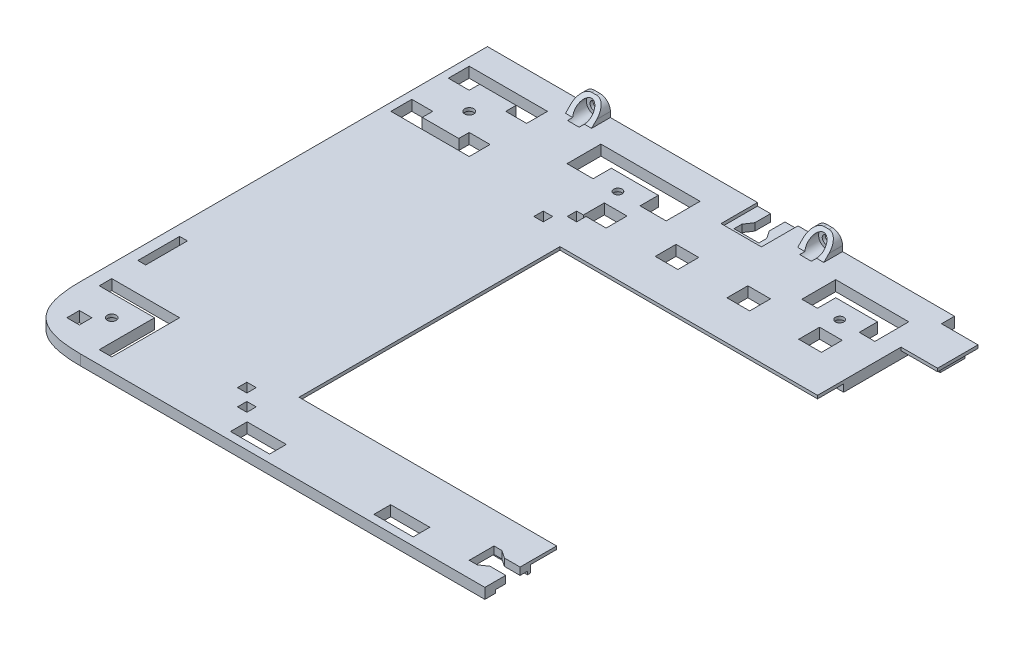
from build123d import *

# Parameters (mm, degrees)
SKETCH1_W                                  = 337
SKETCH1_H                                  = 377.97
SKETCH1_W_2                                = 240
SKETCH1_H_2                                = 120
BOSS_EXTRUDE1_DEPTH                        = 4
FILLET1_SIZE                               = 24
SKETCH3_R                                  = 1.75
SKETCH3_R_2                                = 2
SKETCH3_R_3                                = 1.6
SKETCH3_R_4                                = 1.2
SKETCH3_W                                  = 4.8
SKETCH3_H                                  = 4.8
SKETCH3_W_2                                = 3
SKETCH3_H_2                                = 16
SKETCH3_W_3                                = 4
SKETCH3_H_3                                = 24
SKETCH3_W_4                                = 120
SKETCH3_H_4                                = 135.5
SKETCH3_W_5                                = 16
SKETCH3_H_5                                = 4
SKETCH3_W_6                                = 32
CUT_EXTRUDE1_DEPTH                         = 4
CUT_EXTRUDE2_REACH                         = 508.405
SKETCH5_W                                  = 3.6
SKETCH5_H                                  = 3.6
MIRROR1_AT_THE_SECOND_PLANE_COPY_1_REACH   = 508.405
MIRROR1_AT_THE_SECOND_PLANE_COPY_1_SKETC_W = 3.6
MIRROR1_AT_THE_SECOND_PLANE_COPY_1_SKETC_H = 3.6
SKETCH6_R                                  = 3.5
SKETCH6_R_2                                = 3
CUT_EXTRUDE3_DEPTH                         = 2.8
CUT_EXTRUDE4_REACH                         = 508.405
SKETCH7_W                                  = 8.7
SKETCH7_H                                  = 8
LPATTERN1_COUNT                            = 8
LPATTERN1_PITCH                            = 27.5
CUT_EXTRUDE5_REACH                         = 508.405
CUT_EXTRUDE6_REACH                         = 508.405
SKETCH9_R                                  = 1.6
SKETCH10_R                                 = 3.5
CUT_EXTRUDE7_DEPTH                         = 2.8
CUT_EXTRUDE8_REACH                         = 508.405
SKETCH11_R                                 = 1.6
SKETCH12_R                                 = 3.5
CUT_EXTRUDE9_DEPTH                         = 2.8
SKETCH13_W                                 = 15
SKETCH13_H                                 = 6.4
CUT_EXTRUDE10_DEPTH                        = 4
LPATTERN2_COUNT                            = 4
LPATTERN2_PITCH                            = 55
SKETCH15_W                                 = 240
SKETCH15_H                                 = 120
SKETCH15_W_2                               = 105
SKETCH15_H_2                               = 100
BOSS_EXTRUDE2_DEPTH                        = 1.2
CUT_EXTRUDE11_REACH                        = 508.405
SKETCH17_W                                 = 158
SKETCH17_H                                 = 180
CUT_EXTRUDE12_REACH                        = 508.405
SKETCH19_W                                 = 158
SKETCH19_H                                 = 197.97
CUT_EXTRUDE13_REACH                        = 420.232
SKETCH18_W                                 = 179
SKETCH18_H                                 = 197.97
CUT_EXTRUDE14_REACH                        = 255.884
SKETCH21_W                                 = 14
SKETCH21_H                                 = 12.3
CUT_EXTRUDE17_DEPTH                        = 1.2
BOSS_EXTRUDE3_DEPTH                        = 4
SKETCH23_W                                 = 14
SKETCH23_H                                 = 15.5
BOSS_EXTRUDE4_DEPTH                        = 1.2
SKETCH24_W                                 = 10
SKETCH24_H                                 = 1.2
BOSS_EXTRUDE5_DEPTH                        = 6
CUT_EXTRUDE18_REACH                        = 265.979
SKETCH25_R                                 = 1.6
CHAMFER1_SIZE                              = 6
SKETCH26_R                                 = 3
CUT_EXTRUDE21_DEPTH                        = 8
FILLET2_R                                  = 4
MIRROR3_START                              = -178.8
MIRROR3_OUTLINE_R                          = 3
MIRROR3_OUTLINE_R_2                        = 1.6
MIRROR3_DEPTH                              = 8
MIRROR3_START_2                            = -180
MIRROR3_2_OUTLINE_R                        = 3
MIRROR3_2_OUTLINE_R_2                      = 1.6
MIRROR3_2_DEPTH                            = 1.2
MIRROR3_3_DEPTH                            = 7.2
MIRROR3_START_3                            = 122.188051789
MIRROR3_4_OUTLINE_W                        = 10
MIRROR3_4_OUTLINE_H                        = 6.188051789
MIRROR3_4_DEPTH                            = 9.333809512
CUT_EXTRUDE22_REACH                        = 265.979
SKETCH28_W                                 = 15.5
SKETCH28_H                                 = 14
CUT_EXTRUDE23_DEPTH                        = 1.2


with BuildPart() as part:
    # Sketch1 → Boss-Extrude1 (new body)
    with BuildSketch(Plane(origin=(0, 0, 0), x_dir=(1, 0, 0), z_dir=(0, 1, 0))):
        with Locations((168.5, 188.985)):
            Rectangle(SKETCH1_W, SKETCH1_H)
        with Locations((190.28, 77.5)):
            Rectangle(SKETCH1_W_2, SKETCH1_H_2, mode=Mode.SUBTRACT)
    extrude(amount=-BOSS_EXTRUDE1_DEPTH)

    # Fillet1
    # a fillet whose section is not a circle: 24 mm, written as the material it takes off along each edge
    with BuildSketch(Plane(origin=(0, 60, 0), x_dir=(1, 0, 0), z_dir=(0, -1, 0))) as fillet1_piece_1:
        with BuildLine():
            Bezier((FILLET1_SIZE, 0), (0, 0), (0, -FILLET1_SIZE), weights=[1, 1.222222222, 1])
            Line((0, -FILLET1_SIZE), (0, 0))
            Line((0, 0), (FILLET1_SIZE, 0))
        make_face()
    extrude(amount=124, mode=Mode.SUBTRACT)
    with BuildSketch(Plane(origin=(337, 60, 0), x_dir=(-1, 0, 0), z_dir=(0, -1, 0)), Plane(origin=(0, 60, -377.97), x_dir=(1, 0, 0), z_dir=(0, -1, 0)), Plane(origin=(337, 60, -377.97), x_dir=(0, 0, 1), z_dir=(0, -1, 0))) as fillet1_piece_2:
        with BuildLine():
            Bezier((FILLET1_SIZE, 0), (0, 0), (0, FILLET1_SIZE), weights=[1, 1.222222222, 1])
            Line((0, FILLET1_SIZE), (0, 0))
            Line((0, 0), (FILLET1_SIZE, 0))
        make_face()
    extrude(amount=124, mode=Mode.SUBTRACT)

    # Sketch3 → Cut-Extrude1 (cut)
    with BuildSketch(Plane(origin=(0, 0, 0), x_dir=(1, 0, 0), z_dir=(0, 1, 0))):
        with Locations(Location((322, 15, 0), (0, 0, 270))):
            Circle(SKETCH3_R)
        with Locations(Location((18, 18, 0), (0, 0, 270))):
            Circle(SKETCH3_R)
        with Locations(Location((18, 155, 0), (0, 0, 270))):
            Circle(SKETCH3_R)
        with Locations(Location((325, 160, 0), (0, 0, 270))):
            Circle(SKETCH3_R)
        with Locations(Location((195.4, 373.97, 0), (0, 0, 270))):
            Circle(SKETCH3_R_2)
        with Locations(Location((293, 347.97, 0), (0, 0, 270))):
            Circle(SKETCH3_R_2)
        with Locations(Location((315, 366.97, 0), (0, 0, 270))):
            Circle(SKETCH3_R_3)
        with Locations(Location((326, 366.97, 0), (0, 0, 270))):
            Circle(SKETCH3_R_4)
        with Locations(Location((11, 355.97, 0), (0, 0, 270))):
            Circle(SKETCH3_R_3)
        with Locations(Location((11, 365.97, 0), (0, 0, 270))):
            Circle(SKETCH3_R_4)
        with Locations(Location((223.4, 372.97, 0), (0, 0, 270))):
            Circle(SKETCH3_R_3)
        Polygon((309, 4), (309, 2), (305, 2), (305, 10.5), (309, 10.5), (309, 8.5), (313, 8.5), (313, 4), align=None)
        Polygon((329, 28), (333, 28), (333, 32), (319.28, 32), (319.28, 28), (323.28, 28), (323.28, 24), (329, 24), align=None)
        Polygon((328, 151), (334, 151), (334, 147), (316, 147), (316, 151), (322, 151), (322, 155), (328, 155), align=None)
        Polygon((26.2, 5), (31, 5), (31, 31), (26, 31), (5, 31), (5, 26.2), (26.2, 26.2), align=None)
        with Locations((11.8, 11.8)):
            Rectangle(SKETCH3_W, SKETCH3_H)
        Polygon((3, 140), (33, 140), (33, 144), (33, 148), (25, 148), (25, 144), (11, 144), (11, 148), (3, 148), (3, 144), align=None)
        Polygon((3, 170), (33, 170), (33, 166), (33, 162), (25, 162), (25, 166), (11, 166), (11, 162), (3, 162), (3, 166), align=None)
        Polygon((328, 169), (334, 169), (334, 173), (316, 173), (316, 169), (322, 169), (322, 165), (328, 165), align=None)
        with Locations((331.5, 50)):
            Rectangle(SKETCH3_W_2, SKETCH3_H_2)
        with Locations((5.5, 50)):
            Rectangle(SKETCH3_W_2, SKETCH3_H_2)
        with Locations((189.4, 343.97)):
            Rectangle(SKETCH3_W_3, SKETCH3_H_2)
        with Locations((189.4, 299.97)):
            Rectangle(SKETCH3_W_3, SKETCH3_H_3)
        with Locations((267, 267.22)):
            Rectangle(SKETCH3_W_4, SKETCH3_H_4)
        with Locations((319, 191.47)):
            Rectangle(SKETCH3_W_5, SKETCH3_H_5)
        with Locations((271, 191.47)):
            Rectangle(SKETCH3_W_5, SKETCH3_H_5)
        with Locations((223, 191.47)):
            Rectangle(SKETCH3_W_5, SKETCH3_H_5)
        with Locations((245, 342.97)):
            Rectangle(SKETCH3_W_6, SKETCH3_H_5)
        Polygon((332, 355.97), (304, 355.97), (304, 359.97), (304, 373.97), (308, 373.97), (308, 359.97), (332, 359.97), align=None)
        Polygon((18, 372.97), (22, 372.97), (22, 344.97), (18, 344.97), (4, 344.97), (4, 348.97), (18, 348.97), align=None)
    extrude(amount=-CUT_EXTRUDE1_DEPTH, mode=Mode.SUBTRACT)

    # Sketch5 → Cut-Extrude2 (cut, up to next)
    with BuildSketch(Plane(origin=(0, 0, 0), x_dir=(1, 0, 0), z_dir=(0, 1, 0)), mode=Mode.PRIVATE) as cut_extrude2_sk1:
        with Locations((313.48, 20.7)):
            Rectangle(SKETCH5_W, SKETCH5_H)
    cut_extrude2_tool1 = extrude(cut_extrude2_sk1.sketch, amount=-CUT_EXTRUDE2_REACH, mode=Mode.PRIVATE) & part.part
    # Sketch5 → Cut-Extrude2 (cut, up to next)
    with BuildSketch(Plane(origin=(0, 0, 0), x_dir=(1, 0, 0), z_dir=(0, 1, 0)), mode=Mode.PRIVATE) as cut_extrude2_sk2:
        with Locations((307.08, 14.3)):
            Rectangle(SKETCH5_W, SKETCH5_H)
    cut_extrude2_tool2 = extrude(cut_extrude2_sk2.sketch, amount=-CUT_EXTRUDE2_REACH, mode=Mode.PRIVATE) & part.part
    cut_extrude2_1 = cut_extrude2_tool1.solids().sort_by_distance((313.48, 0, -20.7))[0]
    add(cut_extrude2_1, mode=Mode.SUBTRACT)
    cut_extrude2_2 = cut_extrude2_tool2.solids().sort_by_distance((307.08, 0, -14.3))[0]
    add(cut_extrude2_2, mode=Mode.SUBTRACT)
    cut_extrude2 = cut_extrude2_1 + cut_extrude2_2  # Cut-Extrude2 as one shape, for the pattern or mirror that repeats it

    # Mirror1: Cut-Extrude2 across plane
    add(cut_extrude2.mirror(Plane.XY.offset(-77.5)), mode=Mode.SUBTRACT)

    # Mirror1 at the second plane: Cut-Extrude2 across plane
    add(cut_extrude2.mirror(Plane.ZY.offset(-190.28)), mode=Mode.SUBTRACT)

    # Mirror1 at the second plane copy 1 sketc → Mirror1 at the second plane copy 1 (cut, up to next)
    with BuildSketch(Plane(origin=(380.56, 0, -155), x_dir=(-1, 0, 0), z_dir=(0, 1, 0)), mode=Mode.PRIVATE) as mirror1_at_the_second_plane_copy_1_sk1:
        with Locations((313.48, 20.7)):
            Rectangle(MIRROR1_AT_THE_SECOND_PLANE_COPY_1_SKETC_W, MIRROR1_AT_THE_SECOND_PLANE_COPY_1_SKETC_H)
    mirror1_at_the_second_plane_copy_1_tool1 = extrude(mirror1_at_the_second_plane_copy_1_sk1.sketch, amount=-MIRROR1_AT_THE_SECOND_PLANE_COPY_1_REACH, mode=Mode.PRIVATE) & part.part
    # Mirror1 at the second plane copy 1 sketc → Mirror1 at the second plane copy 1 (cut, up to next)
    with BuildSketch(Plane(origin=(380.56, 0, -155), x_dir=(-1, 0, 0), z_dir=(0, 1, 0)), mode=Mode.PRIVATE) as mirror1_at_the_second_plane_copy_1_sk2:
        with Locations((307.08, 14.3)):
            Rectangle(MIRROR1_AT_THE_SECOND_PLANE_COPY_1_SKETC_W, MIRROR1_AT_THE_SECOND_PLANE_COPY_1_SKETC_H)
    mirror1_at_the_second_plane_copy_1_tool2 = extrude(mirror1_at_the_second_plane_copy_1_sk2.sketch, amount=-MIRROR1_AT_THE_SECOND_PLANE_COPY_1_REACH, mode=Mode.PRIVATE) & part.part
    add(mirror1_at_the_second_plane_copy_1_tool1.solids().sort_by_distance((67.08, 0, -134.3))[0], mode=Mode.SUBTRACT)
    add(mirror1_at_the_second_plane_copy_1_tool2.solids().sort_by_distance((73.48, 0, -140.7))[0], mode=Mode.SUBTRACT)

    # Sketch6 → Cut-Extrude3 (cut)
    with BuildSketch(Plane.XZ.offset(4)):
        with Locations(Location((18, -155, 0), (0, 0, 270))):
            Circle(SKETCH6_R)
        with Locations(Location((18, -18, 0), (0, 0, 270))):
            Circle(SKETCH6_R)
        with Locations(Location((322, -15, 0), (0, 0, 270))):
            Circle(SKETCH6_R)
        with Locations(Location((325, -160, 0), (0, 0, 270))):
            Circle(SKETCH6_R)
        with Locations(Location((195.4, -373.97, 0), (0, 0, 270))):
            Circle(SKETCH6_R)
        with Locations(Location((293, -347.97, 0), (0, 0, 270))):
            Circle(SKETCH6_R)
        with Locations(Location((315, -366.97, 0), (0, 0, 270))):
            Circle(SKETCH6_R)
        with Locations(Location((326, -366.97, 0), (0, 0, 270))):
            Circle(SKETCH6_R_2)
        with Locations(Location((11, -355.97, 0), (0, 0, 270))):
            Circle(SKETCH6_R)
        with Locations(Location((11, -365.97, 0), (0, 0, 270))):
            Circle(SKETCH6_R_2)
        with Locations(Location((223.4, -372.97, 0), (0, 0, 270))):
            Circle(SKETCH6_R)
    extrude(amount=-CUT_EXTRUDE3_DEPTH, mode=Mode.SUBTRACT)

    # Sketch7 → Cut-Extrude4 (cut, up to next)
    with BuildSketch(Plane(origin=(0, 0, 0), x_dir=(1, 0, 0), z_dir=(0, 1, 0)), mode=Mode.PRIVATE) as cut_extrude4_sk1:
        with Locations((271.13, 146.5)):
            Rectangle(SKETCH7_W, SKETCH7_H)
    cut_extrude4_tool1 = extrude(cut_extrude4_sk1.sketch, amount=-CUT_EXTRUDE4_REACH, mode=Mode.PRIVATE) & part.part
    cut_extrude4 = cut_extrude4_tool1.solids().sort_by_distance((271.13, 0, -146.5))[0]
    add(cut_extrude4, mode=Mode.SUBTRACT)

    # LPattern1: Cut-Extrude4 ×8
    with Locations(*[(-i * LPATTERN1_PITCH, 0, 0) for i in range(1, LPATTERN1_COUNT)]):
        add(cut_extrude4, mode=Mode.SUBTRACT)

    # Sketch8 → Cut-Extrude5 (cut, up to next)
    with BuildSketch(Plane(origin=(0, 0, 0), x_dir=(1, 0, 0), z_dir=(0, 1, 0)), mode=Mode.PRIVATE) as cut_extrude5_sk1:
        Polygon((262.1, 156.38), (252.1, 156.38), (252.1, 163.38), (234.1, 163.38), (234.1, 156.38), (224.1, 156.38), (224.1, 163.38), (224.1, 169.38), (262.1, 169.38), (262.1, 163.38), align=None)
    cut_extrude5_tool1 = extrude(cut_extrude5_sk1.sketch, amount=-CUT_EXTRUDE5_REACH, mode=Mode.PRIVATE) & part.part
    cut_extrude5 = cut_extrude5_tool1.solids().sort_by_distance((243.1, 0, -163.907174))[0]
    add(cut_extrude5, mode=Mode.SUBTRACT)

    # Sketch9 → Cut-Extrude6 (cut, up to next)
    with BuildSketch(Plane(origin=(0, 0, 0), x_dir=(1, 0, 0), z_dir=(0, 1, 0)), mode=Mode.PRIVATE) as cut_extrude6_sk1:
        with Locations(Location((243.1, 156.88, 0), (0, 0, 270))):
            Circle(SKETCH9_R)
    cut_extrude6_tool1 = extrude(cut_extrude6_sk1.sketch, amount=-CUT_EXTRUDE6_REACH, mode=Mode.PRIVATE) & part.part
    cut_extrude6 = cut_extrude6_tool1.solids().sort_by_distance((243.1, 0, -156.88))[0]
    add(cut_extrude6, mode=Mode.SUBTRACT)

    # Sketch10 → Cut-Extrude7 (cut)
    with BuildSketch(Plane.XZ.offset(4)):
        with Locations(Location((243.1, -156.88, 0), (0, 0, 270))):
            Circle(SKETCH10_R)
    cut_extrude7 = extrude(amount=-CUT_EXTRUDE7_DEPTH, mode=Mode.SUBTRACT)

    # Mirror2: Cut-Extrude5, Cut-Extrude6, Cut-Extrude7 across plane
    add(cut_extrude5.mirror(Plane(origin=(158.1, 0, 0), x_dir=(0, 0, 1), z_dir=(1, 0, 0))), mode=Mode.SUBTRACT)
    add(cut_extrude6.mirror(Plane(origin=(158.1, 0, 0), x_dir=(0, 0, 1), z_dir=(1, 0, 0))), mode=Mode.SUBTRACT)
    add(cut_extrude7.mirror(Plane(origin=(158.1, 0, 0), x_dir=(0, 0, 1), z_dir=(1, 0, 0))), mode=Mode.SUBTRACT)

    # Sketch11 → Cut-Extrude8 (cut, up to next)
    with BuildSketch(Plane(origin=(0, 0, 0), x_dir=(1, 0, 0), z_dir=(0, 1, 0)), mode=Mode.PRIVATE) as cut_extrude8_sk1:
        with Locations(Location((158.1, 156.88, 0), (0, 0, 270))):
            Circle(SKETCH11_R)
    cut_extrude8_tool1 = extrude(cut_extrude8_sk1.sketch, amount=-CUT_EXTRUDE8_REACH, mode=Mode.PRIVATE) & part.part
    # Sketch11 → Cut-Extrude8 (cut, up to next)
    with BuildSketch(Plane(origin=(0, 0, 0), x_dir=(1, 0, 0), z_dir=(0, 1, 0)), mode=Mode.PRIVATE) as cut_extrude8_sk2:
        Polygon((172.1, 169.38), (144.1, 169.38), (144.1, 163.38), (144.1, 156.38), (150.1, 156.38), (150.1, 163.38), (166.1, 163.38), (166.1, 156.38), (172.1, 156.38), (172.1, 163.38), align=None)
    cut_extrude8_tool2 = extrude(cut_extrude8_sk2.sketch, amount=-CUT_EXTRUDE8_REACH, mode=Mode.PRIVATE) & part.part
    add(cut_extrude8_tool1.solids().sort_by_distance((158.1, 0, -156.88))[0], mode=Mode.SUBTRACT)
    add(cut_extrude8_tool2.solids().sort_by_distance((158.1, 0, -164.213333))[0], mode=Mode.SUBTRACT)

    # Sketch12 → Cut-Extrude9 (cut)
    with BuildSketch(Plane.XZ.offset(4)):
        with Locations(Location((158.1, -156.88, 0), (0, 0, 270))):
            Circle(SKETCH12_R)
    extrude(amount=-CUT_EXTRUDE9_DEPTH, mode=Mode.SUBTRACT)

    # Sketch13 → Cut-Extrude10 (cut)
    with BuildSketch(Plane(origin=(0, 0, 0), x_dir=(1, 0, 0), z_dir=(0, 1, 0))):
        with Locations((86, 6.2)):
            Rectangle(SKETCH13_W, SKETCH13_H)
    cut_extrude10 = extrude(amount=-CUT_EXTRUDE10_DEPTH, mode=Mode.SUBTRACT)

    # LPattern2: Cut-Extrude10 ×4
    with Locations(*[(i * LPATTERN2_PITCH, 0, 0) for i in range(1, LPATTERN2_COUNT)]):
        add(cut_extrude10, mode=Mode.SUBTRACT)

    # Sketch15 → Boss-Extrude2 (add)
    with BuildSketch(Plane(origin=(0, 0, 0), x_dir=(1, 0, 0), z_dir=(0, 1, 0))):
        with Locations((190.28, 77.5)):
            Rectangle(SKETCH15_W, SKETCH15_H)
        with Locations((132.78, 77.5)):
            Rectangle(SKETCH15_W_2, SKETCH15_H_2, mode=Mode.SUBTRACT)
        with Locations((247.78, 77.5)):
            Rectangle(SKETCH15_W_2, SKETCH15_H_2, mode=Mode.SUBTRACT)
    extrude(amount=-BOSS_EXTRUDE2_DEPTH)

    # Sketch17 → Cut-Extrude11 (cut, up to next)
    with BuildSketch(Plane(origin=(0, 0, 0), x_dir=(1, 0, 0), z_dir=(0, 1, 0)), mode=Mode.PRIVATE) as cut_extrude11_sk1:
        with Locations((258, 90)):
            Rectangle(SKETCH17_W, SKETCH17_H)
    cut_extrude11_tool1 = extrude(cut_extrude11_sk1.sketch, amount=-CUT_EXTRUDE11_REACH, mode=Mode.PRIVATE) & part.part
    add(cut_extrude11_tool1.solids().sort_by_distance((258, 0, -90))[0], mode=Mode.SUBTRACT)

    # Sketch19 → Cut-Extrude12 (cut, up to next)
    with BuildSketch(Plane(origin=(0, 0, 0), x_dir=(1, 0, 0), z_dir=(0, 1, 0)), mode=Mode.PRIVATE) as cut_extrude12_sk1:
        with Locations((258, 278.985)):
            Rectangle(SKETCH19_W, SKETCH19_H)
    cut_extrude12_tool1 = extrude(cut_extrude12_sk1.sketch, amount=-CUT_EXTRUDE12_REACH, mode=Mode.PRIVATE) & part.part
    add(cut_extrude12_tool1.solids().sort_by_distance((258, 0, -278.985))[0], mode=Mode.SUBTRACT)

    # Sketch18 → Cut-Extrude13 (cut, up to next)
    with BuildSketch(Plane(origin=(0, 0, 0), x_dir=(1, 0, 0), z_dir=(0, 1, 0)), mode=Mode.PRIVATE) as cut_extrude13_sk1:
        with Locations((89.5, 278.985)):
            Rectangle(SKETCH18_W, SKETCH18_H)
    cut_extrude13_tool1 = extrude(cut_extrude13_sk1.sketch, amount=-CUT_EXTRUDE13_REACH, mode=Mode.PRIVATE) & part.part
    add(cut_extrude13_tool1.solids().sort_by_distance((89.5, 0, -278.985))[0], mode=Mode.SUBTRACT)

    # Sketch20 → Cut-Extrude14 (cut, up to next)
    with BuildSketch(Plane.XZ.offset(4), mode=Mode.PRIVATE) as cut_extrude14_sk1:
        Polygon((179, -8), (173, -8), (170, -6), (167, -6), (167, -15.5), (170, -15.5), (173, -13.5), (179, -13.5), align=None)
    cut_extrude14_tool1 = extrude(cut_extrude14_sk1.sketch, amount=-CUT_EXTRUDE14_REACH, mode=Mode.PRIVATE) & part.part
    add(cut_extrude14_tool1.solids().sort_by_distance((172.214286, -4, -10.75))[0], mode=Mode.SUBTRACT)

    # Sketch21 → Cut-Extrude17 (cut)
    with BuildSketch(Plane(origin=(0, -4, 0), x_dir=(1, 0, 0), z_dir=(0, 1, 0))):
        with Locations((172, 10.15)):
            Rectangle(SKETCH21_W, SKETCH21_H)
    extrude(amount=CUT_EXTRUDE17_DEPTH, mode=Mode.SUBTRACT)

    # Sketch22 → Boss-Extrude3 (add)
    with BuildSketch(Plane(origin=(0, 0, 0), x_dir=(1, 0, 0), z_dir=(0, 1, 0))):
        Polygon((179, 164.5), (185, 164.5), (188, 162.5), (191, 162.5), (191, 172), (188, 172), (185, 170), (179, 170), align=None)
    extrude(amount=-BOSS_EXTRUDE3_DEPTH)

    # Sketch23 → Boss-Extrude4 (add)
    with BuildSketch(Plane(origin=(0, 0, 0), x_dir=(1, 0, 0), z_dir=(0, 1, 0))):
        with Locations((186, 167.25)):
            Rectangle(SKETCH23_W, SKETCH23_H)
    extrude(amount=-BOSS_EXTRUDE4_DEPTH)

    # Sketch24 → Boss-Extrude5 (add)
    with BuildSketch(Plane(origin=(0, 0, 0), x_dir=(1, 0, 0), z_dir=(0, 1, 0))):
        with Locations((131.1, 179.4)):
            Rectangle(SKETCH24_W, SKETCH24_H)
    extrude(amount=BOSS_EXTRUDE5_DEPTH)

    # Sketch25 → Cut-Extrude18 (cut, up to next)
    with BuildSketch(Plane(origin=(0, 0, -180), x_dir=(-1, 0, 0), z_dir=(0, 0, -1)), mode=Mode.PRIVATE) as cut_extrude18_sk1:
        with Locations((-131.1, 2)):
            Circle(SKETCH25_R)
    cut_extrude18_tool1 = extrude(cut_extrude18_sk1.sketch, amount=-CUT_EXTRUDE18_REACH, mode=Mode.PRIVATE) & part.part
    add(cut_extrude18_tool1.solids().sort_by_distance((131.1, 2, -180))[0], mode=Mode.SUBTRACT)

    # Chamfer1
    # the kernel refuses this chamfer: 6 mm, written as the material it adds along each edge
    with BuildSketch(Plane(origin=(136.1, 0, -178.8), x_dir=(0, 0, 1), z_dir=(-1, 0, 0))) as chamfer1_piece_1_section:
        Polygon((CHAMFER1_SIZE, 0), (0, CHAMFER1_SIZE), (0, 0), align=None)
    chamfer1_piece_1 = extrude(amount=10, mode=Mode.PRIVATE)
    chamfer1_piece_1 = split(chamfer1_piece_1, bisect_by=Plane(origin=(136.1, 6, -178.8), z_dir=(0, -1, 0)), keep=Keep.TOP, mode=Mode.PRIVATE)
    chamfer1_piece_1 = chamfer1_piece_1 - Plane(origin=(131.1, 2, -178.8), x_dir=(-1, 0, 0), z_dir=(0, 0, -1)) * Cylinder(1.6, 44, mode=Mode.PRIVATE)
    add(chamfer1_piece_1)

    # Sketch26 → Cut-Extrude21 (cut)
    with BuildSketch(Plane(origin=(0, 0, -178.8), x_dir=(-1, 0, 0), z_dir=(0, 0, -1))):
        with Locations((-131.1, 2)):
            Circle(SKETCH26_R)
    extrude(amount=-CUT_EXTRUDE21_DEPTH, mode=Mode.SUBTRACT)

    # Fillet2
    fillet2_edges = [part.edges().sort_by_distance(p)[0] for p in [
        (126.1, 6, -179.4),
        (136.1, 6, -179.4),
    ]]
    fillet(fillet2_edges, radius=FILLET2_R)

    # Mirror3: read off the stored shape, not the designer's step
    # Mirror3 outline → Mirror3 (cut)
    with BuildSketch(Plane.XY.offset(MIRROR3_START)):
        with Locations((42.1, 2)):
            Circle(MIRROR3_OUTLINE_R)
        with Locations((42.1, 2)):
            Circle(MIRROR3_OUTLINE_R_2, mode=Mode.SUBTRACT)
    extrude(amount=MIRROR3_DEPTH, mode=Mode.SUBTRACT)

    # Mirror3 2 outline → Mirror3 2 (add)
    with BuildSketch(Plane.XY.offset(MIRROR3_START_2)):
        with Locations((42.1, 2)):
            Circle(MIRROR3_2_OUTLINE_R)
        with Locations((42.1, 2)):
            Circle(MIRROR3_2_OUTLINE_R_2, mode=Mode.SUBTRACT)
    extrude(amount=MIRROR3_2_DEPTH)

    # Mirror3 3 outline → Mirror3 3 (add)
    with BuildSketch(Plane.XY.offset(MIRROR3_START_2)):
        with BuildLine():
            ThreePointArc((47.1, 2), (45.928427125, 4.828427125), (43.1, 6))
            Line((43.1, 6), (41.1, 6))
            ThreePointArc((41.1, 6), (38.271572875, 4.828427125), (37.1, 2))
            Line((37.1, 2), (37.1, 0))
            Line((37.1, 0), (39.863932023, 0))
            ThreePointArc((39.863932023, 0), (42.1, 5), (44.336067977, 0))
            Line((44.336067977, 0), (47.1, 0))
            Line((47.1, 0), (47.1, 2))
        make_face()
    extrude(amount=MIRROR3_3_DEPTH)

    # Mirror3 4 outline → Mirror3 4 (cut)
    with BuildSketch(Plane(origin=(0, 0, 0), x_dir=(1, 0, 0), z_dir=(0, 0.7071067811865511, -0.7071067811865441)).offset(MIRROR3_START_3)):
        with Locations((42.1, 119.094025895)):
            Rectangle(MIRROR3_4_OUTLINE_W, MIRROR3_4_OUTLINE_H)
    extrude(amount=MIRROR3_4_DEPTH, mode=Mode.SUBTRACT)

    # Sketch27 → Cut-Extrude22 (cut, up to next)
    with BuildSketch(Plane(origin=(0, 0, 0), x_dir=(1, 0, 0), z_dir=(0, 1, 0)), mode=Mode.PRIVATE) as cut_extrude22_sk1:
        Polygon((108.5, 180), (114, 180), (114, 174), (116, 171), (116, 168), (106.5, 168), (106.5, 171), (108.5, 174), align=None)
    cut_extrude22_tool1 = extrude(cut_extrude22_sk1.sketch, amount=-CUT_EXTRUDE22_REACH, mode=Mode.PRIVATE) & part.part
    add(cut_extrude22_tool1.solids().sort_by_distance((111.25, 0, -173.214286))[0], mode=Mode.SUBTRACT)

    # Sketch28 → Cut-Extrude23 (cut)
    with BuildSketch(Plane(origin=(0, 0, 0), x_dir=(1, 0, 0), z_dir=(0, 1, 0))):
        with Locations((111.25, 173)):
            Rectangle(SKETCH28_W, SKETCH28_H)
    extrude(amount=-CUT_EXTRUDE23_DEPTH, mode=Mode.SUBTRACT)


solid = part.part
